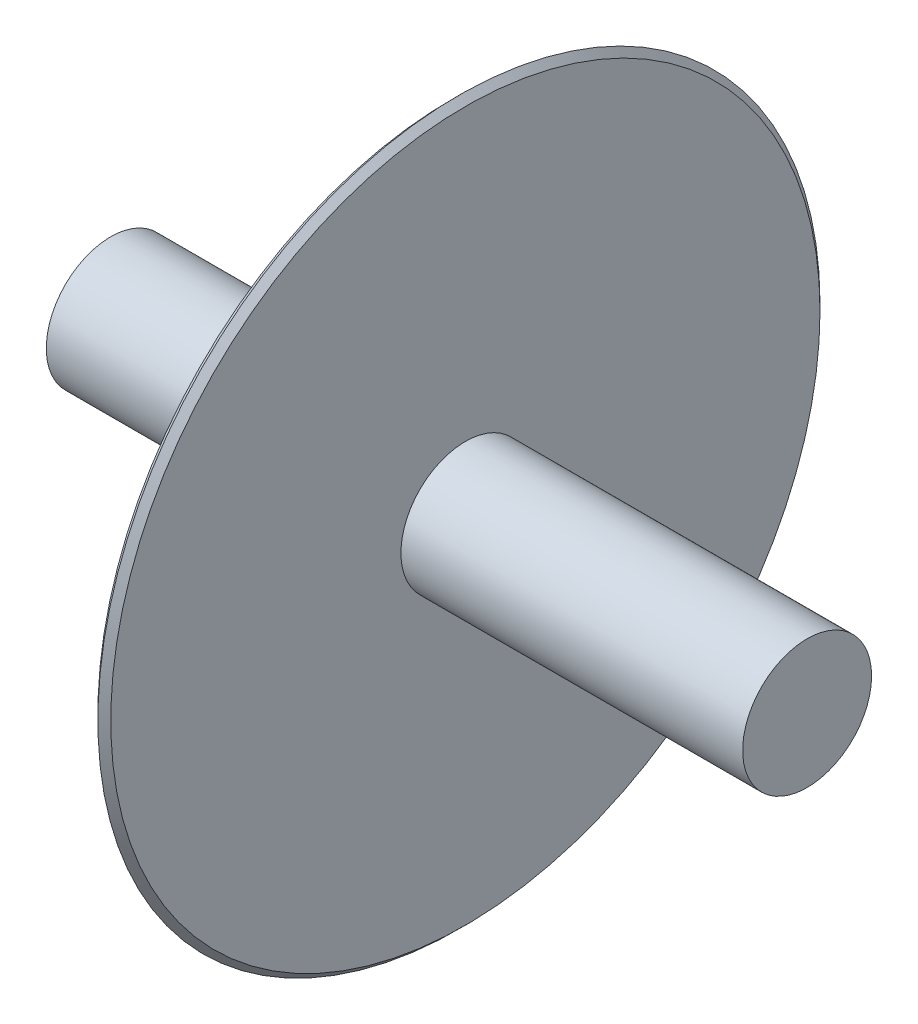
from build123d import *

# Parameters (mm, degrees)
SKETCH1_R           = 2.5
BOSS_EXTRUDE3_DEPTH = 13.5
SKETCH2_R           = 14
BOSS_EXTRUDE4_DEPTH = 0.25
CHAMFER1_SIZE       = 0.25


with BuildPart() as part:
    # Sketch1 → Boss-Extrude3 (new, symmetric)
    with BuildSketch(Plane(origin=(0, 0, 0), x_dir=(0, 0, -1), z_dir=(1, 0, 0))):
        Circle(SKETCH1_R)
    extrude(amount=BOSS_EXTRUDE3_DEPTH, both=True)

    # Sketch2 → Boss-Extrude4 (add, symmetric)
    with BuildSketch(Plane(origin=(0, 0, 0), x_dir=(0, 0, -1), z_dir=(1, 0, 0))):
        Circle(SKETCH2_R)
    extrude(amount=BOSS_EXTRUDE4_DEPTH, both=True)

    # Chamfer1
    chamfer1_edges = [part.edges().sort_by_distance(p)[0] for p in [
        (-0.25, 0, 14),
        (0.25, 0, 14),
    ]]
    chamfer(chamfer1_edges, length=CHAMFER1_SIZE - 0.0001)  # a hair under: the kernel refuses the full size


solid = part.part
